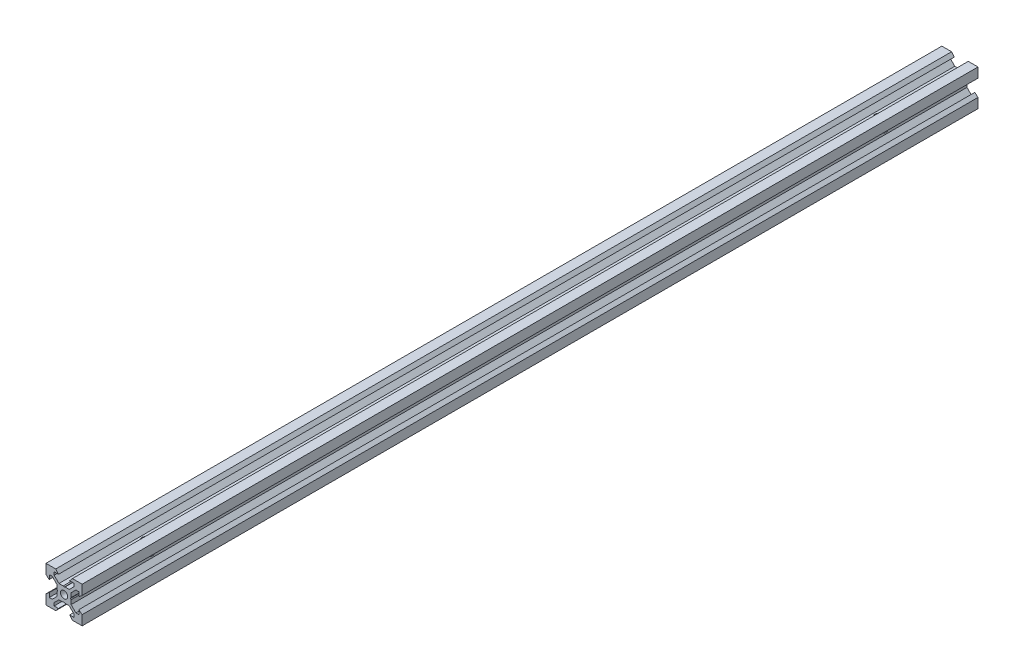
from build123d import *

# Parameters (mm, degrees)
SKETCH1_R               = 2
BOSS_EXTRUDE1_DEPTH     = 496
CUT_EXTRUDE1_DEPTH      = 497.29548658
CUT_EXTRUDE1_DEPTH_BACK = 497.29548658
SKETCH2_R               = 2
CUT_EXTRUDE2_DEPTH      = 497.29548658
CUT_EXTRUDE2_DEPTH_BACK = 497.29548658
SKETCH3_R               = 2


with BuildPart() as part:
    # Sketch1 → Boss-Extrude1 (new body)
    with BuildSketch(Plane.XY):
        Polygon((10, 4.610379336), (10, 10), (4.610379336, 10), (3.1, 8.2), (5.5, 8.2), (5.5, 6.560660172), (2.839339828, 3.9), (0.519615242, 3.9), (0, 3.6), (-0.519615242, 3.9), (-2.839339828, 3.9), (-5.5, 6.560660172), (-5.5, 8.2), (-3.1, 8.2), (-4.610379336, 10), (-10, 10), (-10, 4.610379336), (-8.2, 3.1), (-8.2, 5.5), (-6.560660172, 5.5), (-3.9, 2.839339828), (-3.9, 0.519615242), (-3.6, 0), (-3.9, -0.519615242), (-3.9, -2.839339828), (-6.560660172, -5.5), (-8.2, -5.5), (-8.2, -3.1), (-10, -4.610379336), (-10, -10), (-4.610379336, -10), (-3.1, -8.2), (-5.5, -8.2), (-5.5, -6.560660172), (-2.839339828, -3.9), (-0.519615242, -3.9), (0, -3.6), (0.519615242, -3.9), (2.839339828, -3.9), (5.5, -6.560660172), (5.5, -8.2), (3.1, -8.2), (4.610379336, -10), (10, -10), (10, -4.610379336), (8.2, -3.1), (8.2, -5.5), (6.560660172, -5.5), (3.9, -2.839339828), (3.9, -0.519615242), (3.6, 0), (3.9, 0.519615242), (3.9, 2.839339828), (6.560660172, 5.5), (8.2, 5.5), (8.2, 3.1), align=None)
        Circle(SKETCH1_R, mode=Mode.SUBTRACT)
    extrude(amount=BOSS_EXTRUDE1_DEPTH)

    # Sketch2 → Cut-Extrude1 (cut, two sides: drawn at the far end of the back side and taken through both)
    with BuildSketch(Plane(origin=(0, -3.9, 0), x_dir=(-1, 0, 0), z_dir=(0, -1, 0)).offset(-CUT_EXTRUDE1_DEPTH_BACK)):
        with Locations((0, -451)):
            Circle(SKETCH2_R)
        with Locations((0, -45)):
            Circle(SKETCH2_R)
    extrude(amount=CUT_EXTRUDE1_DEPTH + CUT_EXTRUDE1_DEPTH_BACK, mode=Mode.SUBTRACT)

    # Sketch3 → Cut-Extrude2 (cut, two sides: drawn at the far end of the back side and taken through both)
    with BuildSketch(Plane(origin=(3.9, 0, 0), x_dir=(0, 0, -1), z_dir=(1, 0, 0)).offset(-CUT_EXTRUDE2_DEPTH_BACK)):
        with Locations((-45, 0)):
            Circle(SKETCH3_R)
        with Locations((-451, 0)):
            Circle(SKETCH3_R)
    extrude(amount=CUT_EXTRUDE2_DEPTH + CUT_EXTRUDE2_DEPTH_BACK, mode=Mode.SUBTRACT)


solid = part.part
